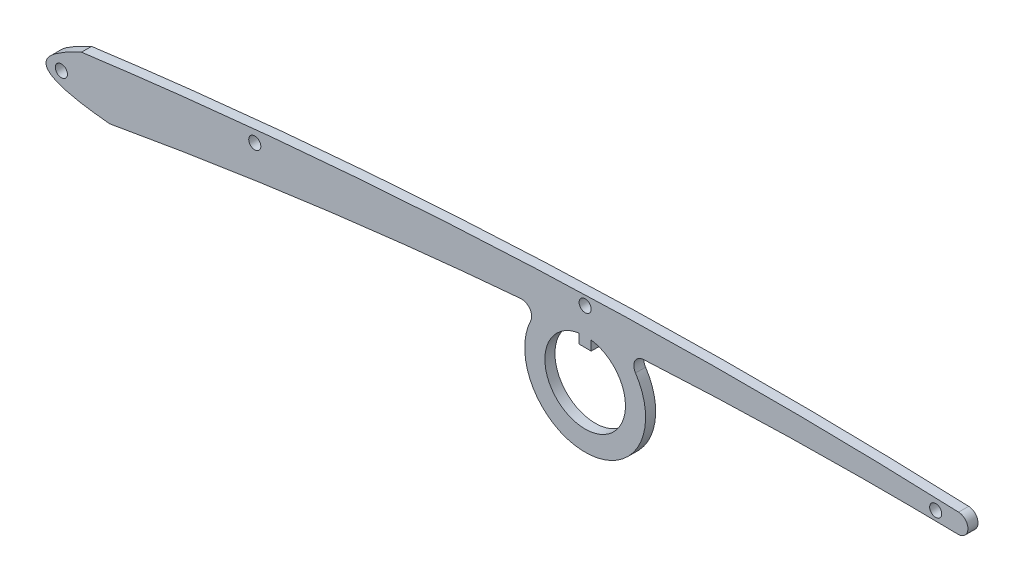
from build123d import *

# Parameters (mm, degrees)
EXTRUDE_1_DEPTH     = 0.25
SKETCH_3_R          = 0.3
SKETCH_3_R_2        = 0.2
CUT_EXTRUDE_1_DEPTH = 0.25
EXTRUDE_2_DEPTH     = 0.25
FILLET_1_R          = 0.5
SKETCH_5_W          = 70.035704888
SKETCH_5_H          = 36.253776648
CUT_EXTRUDE_2_DEPTH = 0.25
FILLET_START        = -1
FILLET_2_DEPTH      = 2


with BuildPart() as part:
    # 草图2 → 凸台-拉伸1 (new, symmetric)
    with BuildSketch(Plane.XY):
        with BuildLine():
            ThreePointArc((94.3, -5.23), (94.279085645, -5.63954323), (94, -5.94))
            add(Edge.make_bspline(
                [(1.4, -2.38), (47.954561827, 5.976867864), (94, -5.94)],
                knots=[0, 0, 0, 1, 1, 1], degree=2))
            add(Edge.make_bspline(
                [(0, 0), (-4.123736473, -1.859487618), (1.4, -2.38)],
                knots=[0, 0, 0, 1, 1, 1], degree=2))
            add(Edge.make_bspline(
                [(0, 0), (47.273266317, 6.255778848), (94.3, -5.23)],
                knots=[0, 0, 0, 1, 1, 1], degree=2))
        make_face()
    extrude(amount=EXTRUDE_1_DEPTH, both=True)

    # 草图3 → 切除-拉伸1 (cut, symmetric)
    with BuildSketch(Plane.XY):
        with Locations((-1, -1.3)):
            Circle(SKETCH_3_R)
        with Locations((8.6, 0.4)):
            Circle(SKETCH_3_R)
        with Locations((25, 1.6)):
            Circle(SKETCH_3_R)
        with Locations((42.4, 1.5)):
            Circle(SKETCH_3_R)
        with Locations((68, -0.5)):
            Circle(SKETCH_3_R_2)
        with Locations((93.8, -5.5)):
            Circle(SKETCH_3_R_2)
    extrude(amount=CUT_EXTRUDE_1_DEPTH, both=True, mode=Mode.SUBTRACT)

    # 草图4 → 凸台-拉伸2 (add, symmetric)
    with BuildSketch(Plane.XY):
        with BuildLine():
            ThreePointArc((22.854587938, 0.396951856), (25.20918356, -4.692698154), (26.83283005, 0.675022949))
            add(Edge.make_bspline(
                [(22.854587938, 0.396951856), (24.844176287, 0.554595418), (26.83283005, 0.675022949)],
                knots=[0, 0, 0, 1, 1, 1], degree=2))
        make_face()
        with BuildLine():
            Line((24.7, 0.277371993), (24.7, -0.2))
            Line((24.7, -0.2), (25.3, -0.2))
            Line((25.3, -0.2), (25.3, 0.277371993))
            ThreePointArc((25.3, 0.277371993), (25, -3.7), (24.7, 0.277371993))
        make_face(mode=Mode.SUBTRACT)
    extrude(amount=EXTRUDE_2_DEPTH, both=True)

    # 圆角1
    fillet_1_edges = [part.edges().sort_by_distance(p)[0] for p in [
        (26.83283005, 0.675022949, -0.125),
        (22.854587938, 0.396951856, -0.125),
    ]]
    fillet(fillet_1_edges, radius=FILLET_1_R)

    # 草图5 → 切除-拉伸2 (cut, symmetric)
    with BuildSketch(Plane.XY):
        with Locations((79.017852444, -9.233575246)):
            Rectangle(SKETCH_5_W, SKETCH_5_H)
    extrude(amount=CUT_EXTRUDE_2_DEPTH, both=True, mode=Mode.SUBTRACT)

    # 圆角2: read off the stored shape, not the designer's step
    # 圆角2 outline → 圆角2 (cut)
    with BuildSketch(Plane.XY.offset(FILLET_START)):
        with BuildLine():
            add(Edge.make_bspline(
                [(44, 1.977919753), (43.768012094, 1.987811641), (43.536018221, 1.997274187)],
                knots=[0.534054584, 0.534054584, 0.534054584, 0.538973918, 0.538973918, 0.538973918], degree=2))
            add(Edge.make_bspline(
                [(43.536018221, 1.997274187), (43.770994303, 1.987690003), (44.000000033, 1.825022881), (44, 1.513981716)],
                knots=[0, 0, 0, 0, 0.492568205, 0.492568205, 0.492568205, 0.492568205], degree=3, weights=[1, 0.675356893, 0.510622658, 0.505797296]))
            Line((44, 1.513981716), (44, 1.977919753))
        make_face()
        with BuildLine():
            Line((44, 1.020922578), (44, 1.513981716))
            add(Edge.make_bspline(
                [(44, 1.513981716), (43.999999965, 1.187287005), (43.753387643, 1.02593813), (43.507593676, 1.030365965)],
                knots=[0.492568205, 0.492568205, 0.492568205, 0.492568205, 1, 1, 1, 1], degree=3, weights=[0.505797296, 0.500826325, 0.66556056, 1]))
            add(Edge.make_bspline(
                [(43.507593676, 1.030365965), (43.753804029, 1.025930629), (44, 1.020922578)],
                knots=[0.453363068, 0.453363068, 0.453363068, 0.458678061, 0.458678061, 0.458678061], degree=2))
        make_face()
    extrude(amount=FILLET_2_DEPTH, mode=Mode.SUBTRACT)


solid = part.part
